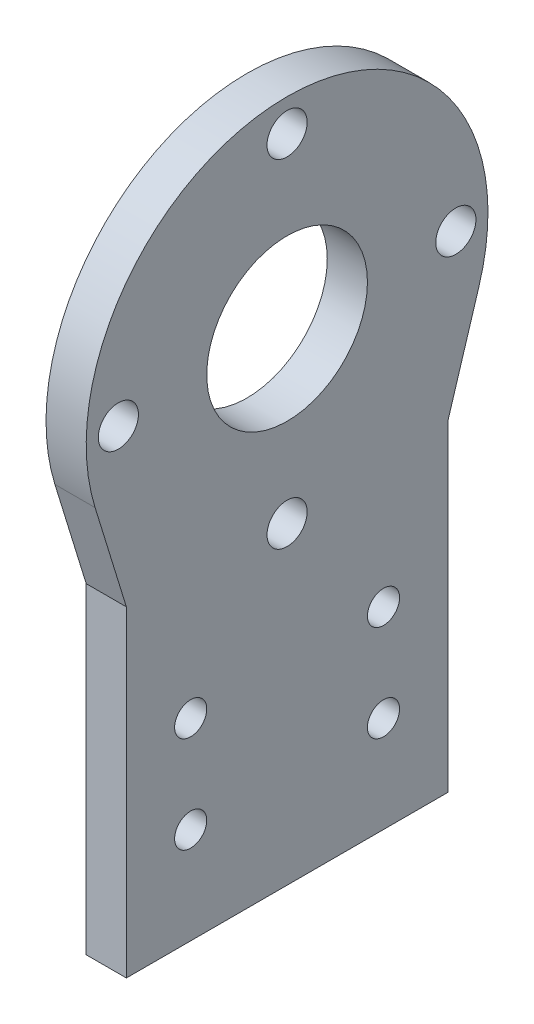
from build123d import *

# Parameters (mm, degrees)
CROQUIS1_R              = 2
CROQUIS1_R_2            = 2.5
CROQUIS1_R_3            = 10
SALIENTE_EXTRUIR1_DEPTH = 5


with BuildPart() as part:
    # Croquis1 → Saliente-Extruir1 (new body)
    with BuildSketch(Plane(origin=(0, 0, 0), x_dir=(0, 0, -1), z_dir=(1, 0, 0))):
        with BuildLine():
            Line((0, 40), (0, 0))
            Line((0, 0), (40, 0))
            Line((40, 0), (40, 40))
            Line((40, 40), (43.892972847, 52.642972847))
            ThreePointArc((43.892972847, 52.642972847), (20, 85), (-3.892972847, 52.642972847))
            Line((-3.892972847, 52.642972847), (0, 40))
        make_face()
        with Locations((8, 12)):
            Circle(CROQUIS1_R, mode=Mode.SUBTRACT)
        with Locations((8, 24)):
            Circle(CROQUIS1_R, mode=Mode.SUBTRACT)
        with Locations((32, 12)):
            Circle(CROQUIS1_R, mode=Mode.SUBTRACT)
        with Locations((32, 24)):
            Circle(CROQUIS1_R, mode=Mode.SUBTRACT)
        with Locations((20, 39)):
            Circle(CROQUIS1_R_2, mode=Mode.SUBTRACT)
        with Locations((20, 81)):
            Circle(CROQUIS1_R_2, mode=Mode.SUBTRACT)
        with Locations((-1, 60)):
            Circle(CROQUIS1_R_2, mode=Mode.SUBTRACT)
        with Locations((20, 60)):
            Circle(CROQUIS1_R_3, mode=Mode.SUBTRACT)
        with Locations((41, 60)):
            Circle(CROQUIS1_R_2, mode=Mode.SUBTRACT)
    extrude(amount=SALIENTE_EXTRUIR1_DEPTH)


solid = part.part
